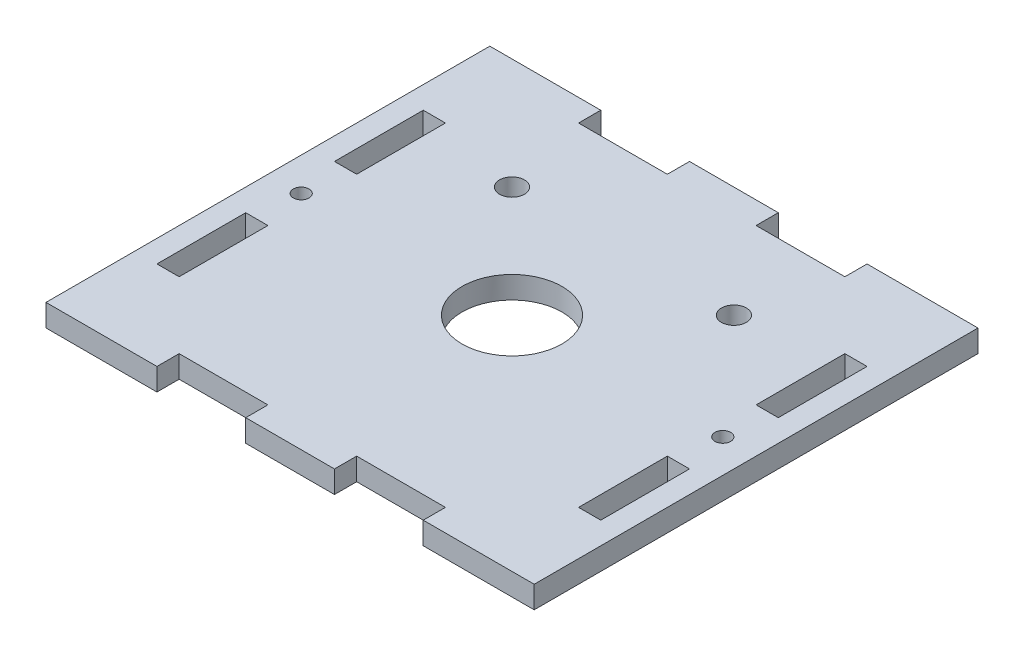
from build123d import *

# Parameters (mm, degrees)
SKETCH1_W                 = 139.7
SKETCH1_H                 = 127
BOSS_EXTRUDE1_DEPTH       = 6.35
SKETCH13_W                = 25.4
SKETCH13_H                = 6.35
CUT_EXTRUDE6_DEPTH        = 6.35
LPATTERN7_COUNT           = 2
LPATTERN7_PITCH           = 120.65
SKETCH14_W                = 6.35
SKETCH14_H                = 25.4
CUT_EXTRUDE7_DEPTH        = 6.35
F_8_CLEARANCE_HOLE1_D     = 4.4958
F_8_CLEARANCE_HOLE1_DEPTH = 10.16
F_8_CLEARANCE_HOLE1_TIP   = 1.350674586
SKETCH18_R                = 14.2875
CUT_EXTRUDE9_DEPTH        = 7.62
SKETCH19_R                = 3.571875
CUT_EXTRUDE10_DEPTH       = 7.62


with BuildPart() as part:
    # Sketch1 → Boss-Extrude1 (new body)
    with BuildSketch(Plane(origin=(0, 0, 0), x_dir=(1, 0, 0), z_dir=(0, 1, 0))):
        with Locations((69.85, 63.5)):
            Rectangle(SKETCH1_W, SKETCH1_H)
    extrude(amount=BOSS_EXTRUDE1_DEPTH)

    # Sketch13 → Cut-Extrude6 (cut)
    with BuildSketch(Plane(origin=(0, 6.35, 0), x_dir=(1, 0, 0), z_dir=(0, 1, 0))):
        with Locations((44.45, 3.175)):
            Rectangle(SKETCH13_W, SKETCH13_H)
        with Locations((95.25, 3.175)):
            Rectangle(SKETCH13_W, SKETCH13_H)
    cut_extrude6 = extrude(amount=-CUT_EXTRUDE6_DEPTH, mode=Mode.SUBTRACT)

    # LPattern7: Cut-Extrude6 ×2
    with Locations(*[(0, 0, -i * LPATTERN7_PITCH) for i in range(1, LPATTERN7_COUNT)]):
        add(cut_extrude6, mode=Mode.SUBTRACT)

    # Sketch14 → Cut-Extrude7 (cut)
    with BuildSketch(Plane(origin=(0, 6.35, 0), x_dir=(1, 0, 0), z_dir=(0, 1, 0))):
        with Locations((9.525, 38.1)):
            Rectangle(SKETCH14_W, SKETCH14_H)
        with Locations((130.175, 38.1)):
            Rectangle(SKETCH14_W, SKETCH14_H)
        with Locations((130.175, 88.9)):
            Rectangle(SKETCH14_W, SKETCH14_H)
        with Locations((9.525, 88.9)):
            Rectangle(SKETCH14_W, SKETCH14_H)
    extrude(amount=-CUT_EXTRUDE7_DEPTH, mode=Mode.SUBTRACT)

    # #8 Clearance Hole1
    with Locations(Plane(origin=(0, 6.35, 0), x_dir=(1, 0, 0), z_dir=(0, 1, 0))):
        with Locations((9.525, 63.5), (130.175, 63.5)):
            Hole(F_8_CLEARANCE_HOLE1_D / 2, depth=F_8_CLEARANCE_HOLE1_DEPTH)
            with Locations((0, 0, -(F_8_CLEARANCE_HOLE1_DEPTH + F_8_CLEARANCE_HOLE1_TIP / 2))):  # 118° drill point
                Cone(0, F_8_CLEARANCE_HOLE1_D / 2, F_8_CLEARANCE_HOLE1_TIP, mode=Mode.SUBTRACT)

    # Sketch18 → Cut-Extrude9 (cut)
    with BuildSketch(Plane(origin=(0, 6.35, 0), x_dir=(1, 0, 0), z_dir=(0, 1, 0))):
        with Locations((69.85, 63.5)):
            Circle(SKETCH18_R)
    extrude(amount=-CUT_EXTRUDE9_DEPTH, mode=Mode.SUBTRACT)

    # Sketch19 → Cut-Extrude10 (cut)
    with BuildSketch(Plane(origin=(0, 6.35, 0), x_dir=(1, 0, 0), z_dir=(0, 1, 0))):
        with Locations((38.1, 95.25)):
            Circle(SKETCH19_R)
        with Locations((101.6, 95.25)):
            Circle(SKETCH19_R)
    extrude(amount=-CUT_EXTRUDE10_DEPTH, mode=Mode.SUBTRACT)


solid = part.part
